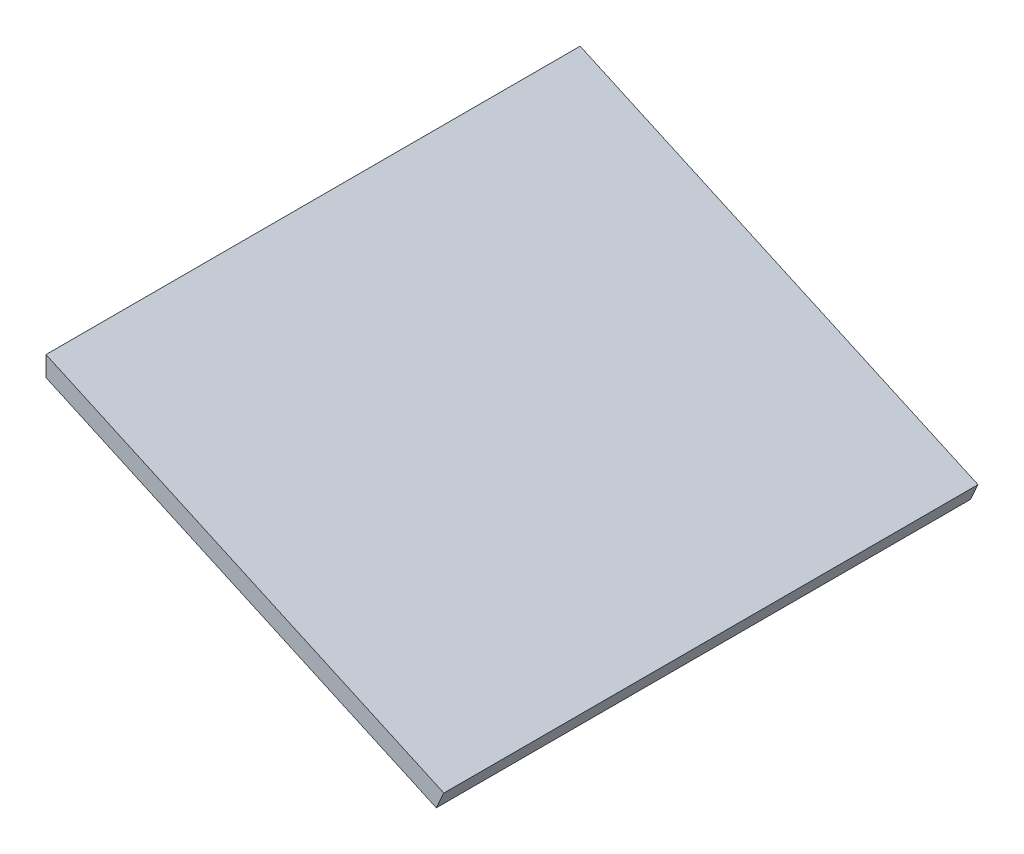
from build123d import *

# Parameters (mm, degrees)
BOSS_EXTRUDE1_DEPTH = 558.8


with BuildPart() as part:
    # Sketch6 → Boss-Extrude1 (new body)
    with BuildSketch(Plane.XY):
        Polygon((-737.18449825, 1672.01539481), (-737.18449825, 1692.941033519), (-320.964944754, 1503.750327384), (-328.847890843, 1486.407845989), align=None)
    extrude(amount=BOSS_EXTRUDE1_DEPTH)


solid = part.part
